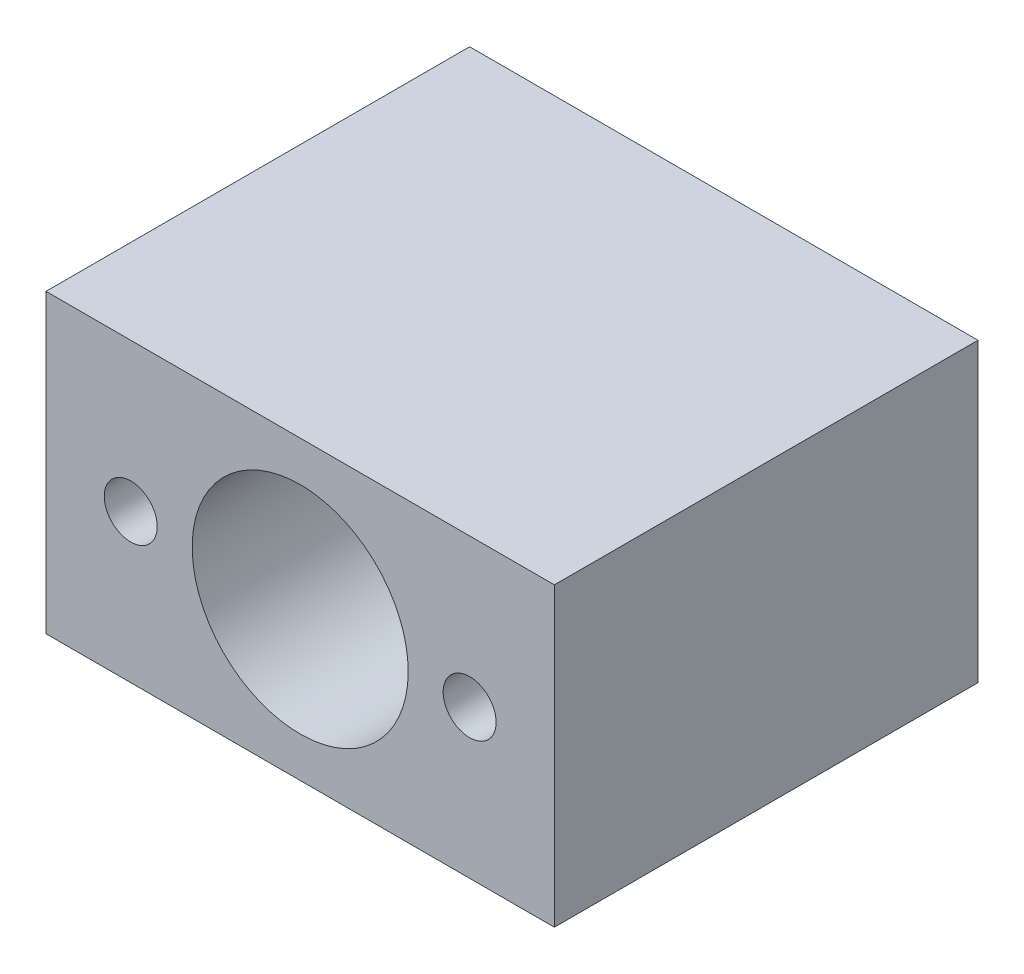
from build123d import *

# Parameters (mm, degrees)
CROQUIS1_W              = 24
CROQUIS1_H              = 14
CROQUIS1_R              = 5.1
CROQUIS1_R_2            = 1.25
SALIENTE_EXTRUIR1_DEPTH = 20


with BuildPart() as part:
    # Croquis1 → Saliente-Extruir1 (new body)
    with BuildSketch(Plane.XY):
        with Locations((12, 7)):
            Rectangle(CROQUIS1_W, CROQUIS1_H)
        with Locations((12, 7)):
            Circle(CROQUIS1_R, mode=Mode.SUBTRACT)
        with Locations((4, 7)):
            Circle(CROQUIS1_R_2, mode=Mode.SUBTRACT)
        with Locations((20, 7)):
            Circle(CROQUIS1_R_2, mode=Mode.SUBTRACT)
    extrude(amount=SALIENTE_EXTRUIR1_DEPTH)


solid = part.part
